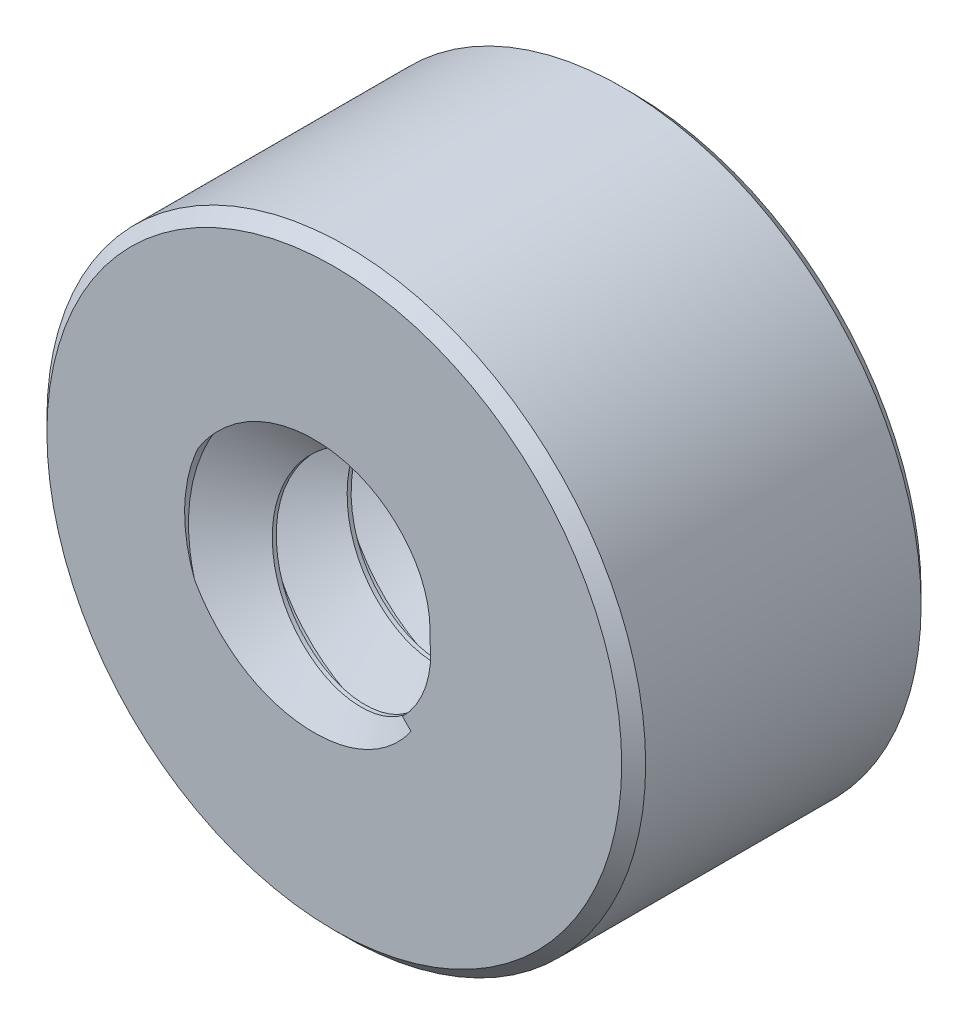
from build123d import *

# Parameters (mm, degrees)
SKETCH1_R           = 6.35
SKETCH1_R_2         = 2.0447
BOSS_EXTRUDE1_DEPTH = 6.35
CUT_SWEEP1_PITCH    = 1.5875
CHAMFER1_SIZE       = 0.254


with BuildPart() as part:
    # Sketch1 → Boss-Extrude1 (new body)
    with BuildSketch(Plane.XY):
        Circle(SKETCH1_R)
        Circle(SKETCH1_R_2, mode=Mode.SUBTRACT)
    extrude(amount=BOSS_EXTRUDE1_DEPTH)

    # Cut-Sweep1: arcs per turn and ends read off the stored shape
    # Cut-Sweep1: the profile of Sketch2 profile screwed along a right-hand helix through 4.75 turns, 8 arcs to a turn; built about Z, then put on its axis
    cut_sweep1_z = Axis((0, 0, 0), (0, 0, 1))
    cut_sweep1_corners = [(2.0444, 0, -1.339811764), (3.175, 0, -0.68705955), (3.175, 0, -0.48862205), (2.0444, 0, 0.164130164)]
    with BuildLine(mode=Mode.PRIVATE) as cut_sweep1_profile:
        Line(cut_sweep1_corners[0], cut_sweep1_corners[1])
        Line(cut_sweep1_corners[1], cut_sweep1_corners[2])
        Line(cut_sweep1_corners[2], cut_sweep1_corners[3])
        Line(cut_sweep1_corners[3], cut_sweep1_corners[0])
    cut_sweep1_cap = Face(cut_sweep1_profile.wire())
    cut_sweep1_turn_angles = [0, 22.5, 45, 67.5, 90, 112.5, 135, 157.5, 180, 202.5, 225, 247.5, 270, 292.5, 315, 337.5, 360]
    cut_sweep1_turn_weights = [1, 0.9238795325112867, 1, 0.9238795325112867, 1, 0.9238795325112867, 1, 0.9238795325112867, 1, 0.9238795325112867, 1, 0.9238795325112867, 1, 0.9238795325112867, 1, 0.9238795325112867, 1]
    cut_sweep1_turn_rails = [Edge.make_bspline([Vector(p[0], p[1], 0).rotate(cut_sweep1_z, cut_sweep1_turn_angles[k]) / cut_sweep1_turn_weights[k] + Vector(0, 0, p[2] + CUT_SWEEP1_PITCH * cut_sweep1_turn_angles[k] / 360) for k in range(17)], [0, 0, 0, 1, 1, 2, 2, 3, 3, 4, 4, 5, 5, 6, 6, 7, 7, 8, 8, 8], 2, cut_sweep1_turn_weights) for p in cut_sweep1_corners]
    cut_sweep1_turn_sides = [Face.make_surface_from_curves(cut_sweep1_turn_rails[p[0]], cut_sweep1_turn_rails[p[1]]) for p in [(0, 1), (1, 2), (2, 3), (3, 0)]]
    cut_sweep1_last_angles = [1440, 1462.5, 1485, 1507.5, 1530, 1552.5, 1575, 1597.5, 1620, 1642.5, 1665, 1687.5, 1710]
    cut_sweep1_last_weights = [1, 0.9238795325112867, 1, 0.9238795325112867, 1, 0.9238795325112867, 1, 0.9238795325112867, 1, 0.9238795325112867, 1, 0.9238795325112769, 1]
    cut_sweep1_last_rails = [Edge.make_bspline([Vector(p[0], p[1], 0).rotate(cut_sweep1_z, cut_sweep1_last_angles[k]) / cut_sweep1_last_weights[k] + Vector(0, 0, p[2] + CUT_SWEEP1_PITCH * cut_sweep1_last_angles[k] / 360) for k in range(13)], [0, 0, 0, 1, 1, 2, 2, 3, 3, 4, 4, 5, 5, 6, 6, 6], 2, cut_sweep1_last_weights) for p in cut_sweep1_corners]
    cut_sweep1_last_sides = [Face.make_surface_from_curves(cut_sweep1_last_rails[p[0]], cut_sweep1_last_rails[p[1]]) for p in [(0, 1), (1, 2), (2, 3), (3, 0)]]
    cut_sweep1 = Plane(origin=(0, 0, 0), x_dir=(0.7071067811865512, 0.7071067811865438, 0), z_dir=(0, 0, 1)) * Solid(Shell([*[p.moved(Location((0, 0, CUT_SWEEP1_PITCH * i))) for i in range(4) for p in cut_sweep1_turn_sides], *cut_sweep1_last_sides, cut_sweep1_cap, cut_sweep1_cap.rotate(cut_sweep1_z, 1710).moved(Location((0, 0, CUT_SWEEP1_PITCH * 1710 / 360)))]))
    add(cut_sweep1, mode=Mode.SUBTRACT)

    # Chamfer1
    chamfer1_edges = [part.edges().sort_by_distance(p)[0] for p in [
        (-6.35, 0, 0),
        (-6.35, 0, 6.35),
    ]]
    chamfer(chamfer1_edges, length=CHAMFER1_SIZE)


solid = part.part
